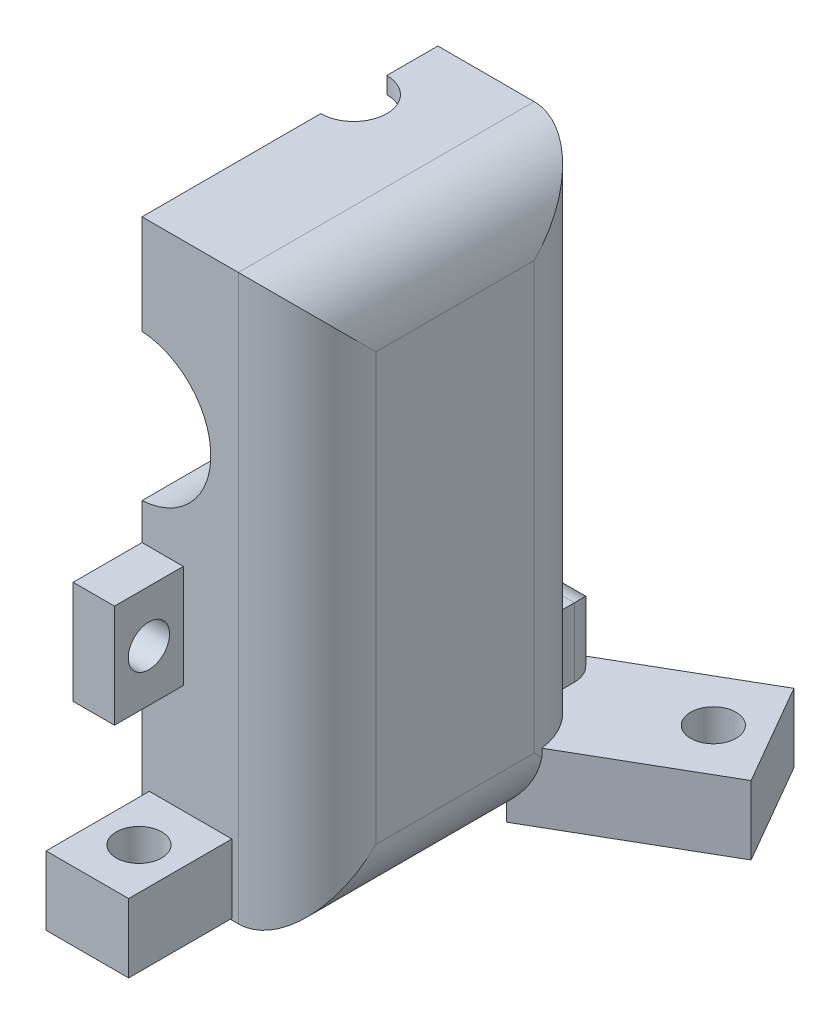
from build123d import *

# Parameters (mm, degrees)
CROQUIS2_W              = 43
CROQUIS2_H              = 82
SALIENTE_EXTRUIR1_DEPTH = 24
CROQUIS3_W              = 24.22772491
CROQUIS3_H              = 79.582021813
CORTAR_EXTRUIR1_DEPTH   = 16
CROQUIS4_W              = 16.121738507
CROQUIS4_H              = 21.293525096
CORTAR_EXTRUIR2_DEPTH   = 10
CORTAR_EXTRUIR4_DEPTH   = 89.103632161
REDONDEO1_R             = 10
SALIENTE_EXTRUIR3_DEPTH = 16
CROQUIS8_W              = 4.909457408
CROQUIS8_H              = 15
SALIENTE_EXTRUIR4_DEPTH = 10
CORTAR_EXTRUIR5_START   = -4.909458
CROQUIS9_R              = 3
CORTAR_EXTRUIR5_DEPTH   = 4.909458
SALIENTE_EXTRUIR5_DEPTH = 9.5
CROQUIS12_W             = 8.494170986
CROQUIS12_H             = 20
SALIENTE_EXTRUIR6_DEPTH = 18
CROQUIS12_3_W           = 8.498446764
CROQUIS12_3_H           = 21
CORTAR_EXTRUIR6_DEPTH   = 15
CROQUIS13_W             = 4.947680971
CROQUIS13_H             = 17.318298189
CORTAR_EXTRUIR8_DEPTH   = 15
REDONDEO6_R             = 4
CROQUIS14_W             = 12
CROQUIS14_H             = 10
SALIENTE_EXTRUIR7_DEPTH = 15
CROQUIS16_R             = 3.3
CORTAR_EXTRUIR9_DEPTH   = 85.026241651
SALIENTE_EXTRUIR8_DEPTH = 10
CROQUIS21_R             = 3.3
CORTAR_EXTRUIR10_DEPTH  = 93.393365129
CROQUIS22_W             = 6
CROQUIS22_H             = 15
SALIENTE_EXTRUIR9_DEPTH = 10
CROQUIS23_R             = 3
CORTAR_EXTRUIR11_DEPTH  = 10


with BuildPart() as part:
    # Croquis2 → Saliente-Extruir1 (new body)
    with BuildSketch(Plane(origin=(0, 0, 0), x_dir=(0, 0, -1), z_dir=(1, 0, 0))):
        Rectangle(CROQUIS2_W, CROQUIS2_H)
    extrude(amount=SALIENTE_EXTRUIR1_DEPTH)

    # Croquis3 → Cortar-Extruir1 (cut)
    with BuildSketch(Plane.ZY):
        with Locations((-6.735600962, -1.208989093)):
            Rectangle(CROQUIS3_W, CROQUIS3_H)
    extrude(amount=-CORTAR_EXTRUIR1_DEPTH, mode=Mode.SUBTRACT)

    # Croquis4 → Cortar-Extruir2 (cut)
    with BuildSketch(Plane.ZY):
        with Locations((13.439130747, 15.935259265)):
            Rectangle(CROQUIS4_W, CROQUIS4_H)
    extrude(amount=-CORTAR_EXTRUIR2_DEPTH, mode=Mode.SUBTRACT)

    # Croquis5 → Cortar-Extruir4 (cut, through all)
    with BuildSketch(Plane(origin=(0, 41, 0), x_dir=(1, 0, 0), z_dir=(0, 1, 0))):
        with BuildLine():
            Line((0, 14.078023223), (0, 4.478023223))
            ThreePointArc((0, 4.478023223), (4.8, 9.278023223), (0, 14.078023223))
        make_face()
    extrude(amount=-CORTAR_EXTRUIR4_DEPTH, mode=Mode.SUBTRACT)

    # Redondeo1
    # the kernel refuses this fillet: 10 mm, written as the material it takes off along each edge
    with BuildSketch(Plane(origin=(24, 66, -21.5), x_dir=(0, 0, 1), z_dir=(0, -1, 0))) as redondeo1_piece_1:
        with BuildLine():
            CenterArc((REDONDEO1_R, REDONDEO1_R), REDONDEO1_R, 180, 90)
            Line((0, REDONDEO1_R), (0, 0))
            Line((0, 0), (REDONDEO1_R, 0))
        make_face()
    extrude(amount=132, mode=Mode.SUBTRACT)
    with BuildSketch(Plane(origin=(24, 41, 46.5), x_dir=(0, -1, 0), z_dir=(0, 0, -1))) as redondeo1_piece_2:
        with BuildLine():
            CenterArc((REDONDEO1_R, REDONDEO1_R), REDONDEO1_R, 180, 90)
            Line((0, REDONDEO1_R), (0, 0))
            Line((0, 0), (REDONDEO1_R, 0))
        make_face()
    extrude(amount=93, mode=Mode.SUBTRACT)
    with BuildSketch(Plane(origin=(24, -66, 21.5), x_dir=(-1, 0, 0), z_dir=(0, 1, 0))) as redondeo1_piece_3:
        with BuildLine():
            CenterArc((REDONDEO1_R, -REDONDEO1_R), REDONDEO1_R, 90, 90)
            Line((0, -REDONDEO1_R), (0, 0))
            Line((0, 0), (REDONDEO1_R, 0))
        make_face()
    extrude(amount=132, mode=Mode.SUBTRACT)
    with BuildSketch(Plane(origin=(24, -41, -46.5), x_dir=(-1, 0, 0), z_dir=(0, 0, 1))) as redondeo1_piece_4:
        with BuildLine():
            CenterArc((REDONDEO1_R, -REDONDEO1_R), REDONDEO1_R, 90, 90)
            Line((0, -REDONDEO1_R), (0, 0))
            Line((0, 0), (REDONDEO1_R, 0))
        make_face()
    extrude(amount=93, mode=Mode.SUBTRACT)

    # Croquis7 → Saliente-Extruir3 (add)
    with BuildSketch(Plane.XY.offset(21.5)):
        with BuildLine():
            Line((0, -41), (14, -41))
            Line((14, -41), (14, 41))
            Line((14, 41), (0, 41))
            Line((0, 41), (0, 26.582021813))
            ThreePointArc((0, 26.582021813), (10, 15.935259265), (0, 5.288496717))
            Line((0, 5.288496717), (0, -41))
        make_face()
    extrude(amount=-SALIENTE_EXTRUIR3_DEPTH)

    # Croquis8 → Saliente-Extruir4 (add)
    with BuildSketch(Plane(origin=(0, 0, -21.5), x_dir=(-1, 0, 0), z_dir=(0, 0, -1))):
        with Locations((-2.454728704, 13.5)):
            Rectangle(CROQUIS8_W, CROQUIS8_H)
        with Locations((-2.454728704, -13.5)):
            Rectangle(CROQUIS8_W, CROQUIS8_H)
    extrude(amount=SALIENTE_EXTRUIR4_DEPTH)

    # Croquis9 → Cortar-Extruir5 (cut)
    with BuildSketch(Plane(origin=(4.909457408, 0, 0), x_dir=(0, 0, -1), z_dir=(1, 0, 0)).offset(CORTAR_EXTRUIR5_START)):
        with Locations(Location((26.5, 13.5, 0), (0, 0, 90))):
            Circle(CROQUIS9_R)
        with Locations(Location((26.5, -13.5, 0), (0, 0, 90))):
            Circle(CROQUIS9_R)
    extrude(amount=CORTAR_EXTRUIR5_DEPTH, mode=Mode.SUBTRACT)

    # Croquis10 → Saliente-Extruir5 (add)
    with BuildSketch(Plane(origin=(0, -41, 0), x_dir=(-1, 0, 0), z_dir=(0, -1, 0))):
        with BuildLine():
            Line((0, -19.532438339), (0, -13.132438339))
            ThreePointArc((0, -13.132438339), (-3.2, -16.332438339), (0, -19.532438339))
        make_face()
    extrude(amount=SALIENTE_EXTRUIR5_DEPTH)

    # Croquis12 → Saliente-Extruir6 (add)
    with BuildSketch(Plane.ZY):
        with Locations((-23.09654891, -31)):
            Rectangle(CROQUIS12_W, CROQUIS12_H)
    extrude(amount=-SALIENTE_EXTRUIR6_DEPTH)

    # Croquis12<3> → Cortar-Extruir6 (cut)
    with BuildSketch(Plane.ZY):
        with Locations((9.627484875, -30.5)):
            Rectangle(CROQUIS12_3_W, CROQUIS12_3_H)
    extrude(amount=-CORTAR_EXTRUIR6_DEPTH, mode=Mode.SUBTRACT)

    # Croquis13 → Cortar-Extruir8 (cut)
    with BuildSketch(Plane.ZY):
        with Locations((-21.323303903, -32.340850905)):
            Rectangle(CROQUIS13_W, CROQUIS13_H)
    extrude(amount=-CORTAR_EXTRUIR8_DEPTH, mode=Mode.SUBTRACT)

    # Redondeo6
    redondeo6_edges = [part.edges().sort_by_distance(p)[0] for p in [
        (11.454728704, -21, -27.343634403),
        (9, -41, -27.343634403),
        (18, -31, -27.343634403),
    ]]
    fillet(redondeo6_edges, radius=REDONDEO6_R)

    # Croquis14 → Saliente-Extruir7 (add)
    with BuildSketch(Plane.XY.offset(21.5)):
        with Locations((7.059903913, -35.778543354)):
            Rectangle(CROQUIS14_W, CROQUIS14_H)
    extrude(amount=SALIENTE_EXTRUIR7_DEPTH)

    # Croquis16 → Cortar-Extruir9 (cut, through all)
    with BuildSketch(Plane(origin=(0, -30.778543354, 0), x_dir=(1, 0, 0), z_dir=(0, 1, 0))):
        with Locations(Location((7.059903913, -29, 0), (0, 0, 270))):
            Circle(CROQUIS16_R)
        with Locations((33.516786786, 28.018487534)):
            Circle(CROQUIS16_R)
    extrude(amount=-CORTAR_EXTRUIR9_DEPTH, mode=Mode.SUBTRACT)

    # Croquis19 → Saliente-Extruir8 (add)
    with BuildSketch(Plane(origin=(0, -41, 0), x_dir=(1, 0, 0), z_dir=(0, 1, 0))):
        Polygon((43.22114317, 23.806345729), (20.704482672, 10.806345729), (12.204482672, 25.528777593), (34.72114317, 38.528777593), align=None)
    extrude(amount=SALIENTE_EXTRUIR8_DEPTH)

    # Croquis21 → Cortar-Extruir10 (cut, through all)
    with BuildSketch(Plane(origin=(0, -31, 0), x_dir=(1, 0, 0), z_dir=(0, 1, 0))):
        with Locations(Location((33.516786786, 28.018487534, 0), (0, 0, 270))):
            Circle(CROQUIS21_R)
    extrude(amount=-CORTAR_EXTRUIR10_DEPTH, mode=Mode.SUBTRACT)

    # Croquis22 → Saliente-Extruir9 (add)
    with BuildSketch(Plane.XY.offset(21.5)):
        with Locations((3, -7.5)):
            Rectangle(CROQUIS22_W, CROQUIS22_H)
    extrude(amount=SALIENTE_EXTRUIR9_DEPTH)

    # Croquis23 → Cortar-Extruir11 (cut)
    with BuildSketch(Plane(origin=(6, 0, 0), x_dir=(0, 0, -1), z_dir=(1, 0, 0))):
        with Locations(Location((-26.5, -7.5, 0), (0, 0, 90))):
            Circle(CROQUIS23_R)
    extrude(amount=-CORTAR_EXTRUIR11_DEPTH, mode=Mode.SUBTRACT)


solid = part.part
